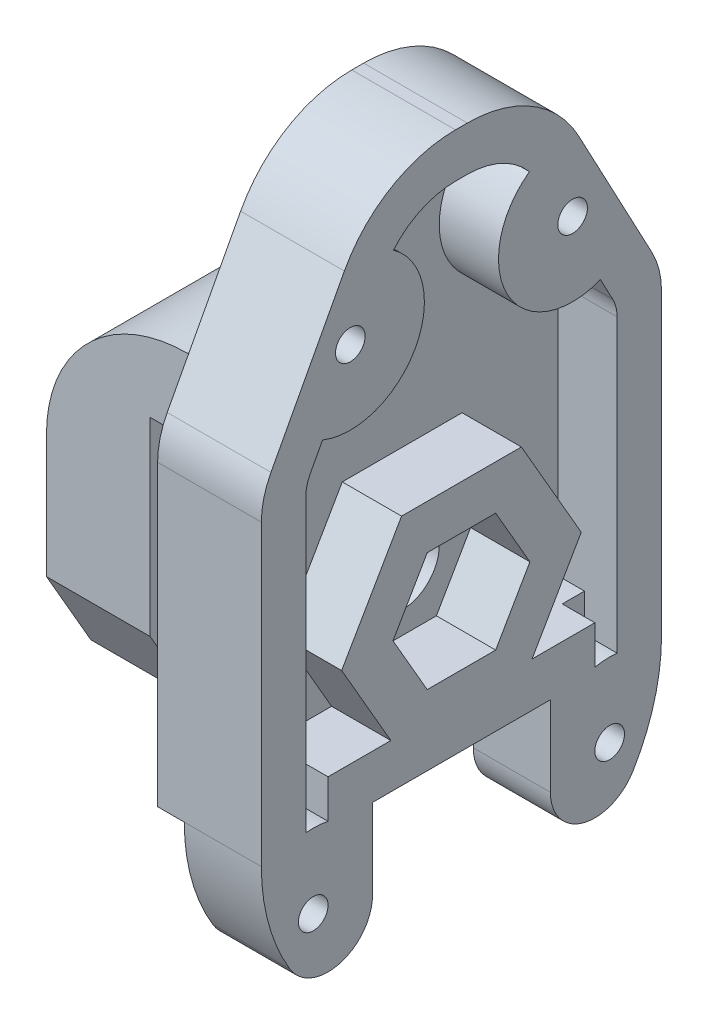
from build123d import *

# Parameters (mm, degrees)
BOSS_EXTRUDE1_DEPTH = 7
FILLET1_R           = 8.5
FILLET2_R           = 5.5
FILLET3_R           = 13.5
SKETCH3_W           = 27
SKETCH3_H           = 13.5
CUT_EXTRUDE1_DEPTH  = 1.8
BOSS_EXTRUDE2_DEPTH = 5
BOSS_EXTRUDE3_DEPTH = 7
SKETCH10_R          = 2.5
CUT_EXTRUDE3_DEPTH  = 21
CUT_EXTRUDE5_REACH  = 41.994
SKETCH12_W          = 12
SKETCH12_H          = 13.5
CUT_EXTRUDE6_REACH  = 39.182
SKETCH13_R          = 1
SKETCH17_R          = 2
CUT_EXTRUDE14_DEPTH = 4
FILLET4_R           = 3
CUT_EXTRUDE16_REACH = 42.725
SKETCH19_W          = 12
SKETCH19_H          = 4.5
CHAMFER5_SIZE       = 3
CHAMFER5_SIZE2      = 5.196152423
CUT_EXTRUDE17_DEPTH = 4
SHELL1_START        = 3
SHELL1_DEPTH        = 4
SHELL1_START_2      = -9
SHELL1_2_OUTLINE_R  = 5.5
SHELL1_2_DEPTH      = 1
SHELL1_START_3      = 4.8
SHELL1_3_DEPTH      = 2.2
SKETCH21_R          = 4.3
CUT_EXTRUDE18_DEPTH = 5
FILLET5_R           = 9.5
FILLET6_R           = 2.5


# Read off the part's stored shape, not the designer's step: Shell1
with BuildPart() as part:
    # Sketch2 → Boss-Extrude1 (new body)
    with BuildSketch(Plane(origin=(0, 0, 0), x_dir=(0, 0, -1), z_dir=(1, 0, 0))):
        Polygon((-13.5, -17.5), (13.5, -17.5), (13.5, 17.5), (5.5, 32.5), (-5.5, 32.5), (-13.5, 17.5), align=None)
    extrude(amount=BOSS_EXTRUDE1_DEPTH)

    # Fillet1
    fillet1_edges = [part.edges().sort_by_distance(p)[0] for p in [
        (3.5, 32.5, 5.5),
        (3.5, 32.5, -5.5),
    ]]
    fillet(fillet1_edges, radius=FILLET1_R)

    # Fillet2
    fillet2_edges = [part.edges().sort_by_distance(p)[0] for p in [
        (3.5, 17.5, -13.5),
        (3.5, 17.5, 13.5),
    ]]
    fillet(fillet2_edges, radius=FILLET2_R)

    # Fillet3
    fillet3_edges = [part.edges().sort_by_distance(p)[0] for p in [
        (3.5, -17.5, 13.5),
        (3.5, -17.5, -13.5),
    ]]
    fillet(fillet3_edges, radius=FILLET3_R - 0.0001)  # a hair under: the kernel refuses the full size

    # Sketch3 → Cut-Extrude1 (cut)
    with BuildSketch(Plane.ZY):
        with Locations((0, -10.75)):
            Rectangle(SKETCH3_W, SKETCH3_H)
    extrude(amount=-CUT_EXTRUDE1_DEPTH, mode=Mode.SUBTRACT)

    # Sketch6 → Boss-Extrude2 (add)
    with BuildSketch(Plane.ZY):
        with BuildLine():
            Line((-13.5, 14), (13.5, 14))
            Line((13.5, 14), (13.5, 16.125))
            ThreePointArc((13.5, 16.125), (13.293303509, 17.618632471), (12.688749833, 19))
            Line((12.688749833, 19), (-12.688749833, 19))
            ThreePointArc((-12.688749833, 19), (-13.293303509, 17.618632471), (-13.5, 16.125))
            Line((-13.5, 16.125), (-13.5, 14))
        make_face()
    extrude(amount=BOSS_EXTRUDE2_DEPTH)

    # Sketch9 → Boss-Extrude3 (add)
    with BuildSketch(Plane.ZY.offset(5)):
        with BuildLine():
            Line((-13.5, 14), (-13.5, -4))
            Line((-13.5, -4), (13.5, -4))
            Line((13.5, -4), (13.5, 14))
            Line((13.5, 14), (13.5, 16.125))
            ThreePointArc((13.5, 16.125), (13.293303509, 17.618632471), (12.688749833, 19))
            Line((12.688749833, 19), (-12.688749833, 19))
            ThreePointArc((-12.688749833, 19), (-13.293303509, 17.618632471), (-13.5, 16.125))
            Line((-13.5, 16.125), (-13.5, 14))
        make_face()
    extrude(amount=BOSS_EXTRUDE3_DEPTH)

    # Sketch10 → Cut-Extrude3 (cut)
    with BuildSketch(Plane(origin=(7, 0, 0), x_dir=(0, 0, -1), z_dir=(1, 0, 0))):
        with Locations((0, 4.75)):
            Circle(SKETCH10_R)
    extrude(amount=-CUT_EXTRUDE3_DEPTH, mode=Mode.SUBTRACT)

    # Sketch12 → Cut-Extrude5 (cut, up to next)
    with BuildSketch(Plane(origin=(7, 0, 0), x_dir=(0, 0, -1), z_dir=(1, 0, 0)), mode=Mode.PRIVATE) as cut_extrude5_sk1:
        with Locations((0, -10.75)):
            Rectangle(SKETCH12_W, SKETCH12_H)
    cut_extrude5_tool1 = extrude(cut_extrude5_sk1.sketch, amount=-CUT_EXTRUDE5_REACH, mode=Mode.PRIVATE) & part.part
    add(cut_extrude5_tool1.solids().sort_by_distance((7, -10.75, 0))[0], mode=Mode.SUBTRACT)

    # Sketch13 → Cut-Extrude6 (cut, up to next)
    with BuildSketch(Plane.ZY, mode=Mode.PRIVATE) as cut_extrude6_sk1:
        with Locations((-7.5, 23.5)):
            Circle(SKETCH13_R)
    cut_extrude6_tool1 = extrude(cut_extrude6_sk1.sketch, amount=-CUT_EXTRUDE6_REACH, mode=Mode.PRIVATE) & part.part
    # Sketch13 → Cut-Extrude6 (cut, up to next)
    with BuildSketch(Plane.ZY, mode=Mode.PRIVATE) as cut_extrude6_sk2:
        with Locations((-10, -8.5)):
            Circle(SKETCH13_R)
    cut_extrude6_tool2 = extrude(cut_extrude6_sk2.sketch, amount=-CUT_EXTRUDE6_REACH, mode=Mode.PRIVATE) & part.part
    # Sketch13 → Cut-Extrude6 (cut, up to next)
    with BuildSketch(Plane.ZY, mode=Mode.PRIVATE) as cut_extrude6_sk3:
        with Locations((10, -8.5)):
            Circle(SKETCH13_R)
    cut_extrude6_tool3 = extrude(cut_extrude6_sk3.sketch, amount=-CUT_EXTRUDE6_REACH, mode=Mode.PRIVATE) & part.part
    # Sketch13 → Cut-Extrude6 (cut, up to next)
    with BuildSketch(Plane.ZY, mode=Mode.PRIVATE) as cut_extrude6_sk4:
        with Locations((7.5, 23.5)):
            Circle(SKETCH13_R)
    cut_extrude6_tool4 = extrude(cut_extrude6_sk4.sketch, amount=-CUT_EXTRUDE6_REACH, mode=Mode.PRIVATE) & part.part
    add(cut_extrude6_tool1.solids().sort_by_distance((0, 23.5, -7.5))[0], mode=Mode.SUBTRACT)
    add(cut_extrude6_tool2.solids().sort_by_distance((0, -8.5, -10))[0], mode=Mode.SUBTRACT)
    add(cut_extrude6_tool3.solids().sort_by_distance((0, -8.5, 10))[0], mode=Mode.SUBTRACT)
    add(cut_extrude6_tool4.solids().sort_by_distance((0, 23.5, 7.5))[0], mode=Mode.SUBTRACT)

    # Sketch17 → Cut-Extrude14 (cut)
    with BuildSketch(Plane.ZY):
        with Locations((-7.5, 23.5)):
            Circle(SKETCH17_R)
        with Locations((7.5, 23.5)):
            Circle(SKETCH17_R)
        with Locations((-10, -8.5)):
            Circle(SKETCH17_R)
        with Locations((10, -8.5)):
            Circle(SKETCH17_R)
    extrude(amount=-CUT_EXTRUDE14_DEPTH, mode=Mode.SUBTRACT)

    # Fillet4
    fillet4_edges = [part.edges().sort_by_distance(p)[0] for p in [
        (4.4, -16.093424605, -6),
        (4.4, -16.093424605, 6),
    ]]
    fillet(fillet4_edges, radius=FILLET4_R)

    # Sketch19 → Cut-Extrude16 (cut, up to next)
    with BuildSketch(Plane.XZ.offset(4), mode=Mode.PRIVATE) as cut_extrude16_sk1:
        with Locations((-6, -11.25)):
            Rectangle(SKETCH19_W, SKETCH19_H)
    cut_extrude16_tool1 = extrude(cut_extrude16_sk1.sketch, amount=-CUT_EXTRUDE16_REACH, mode=Mode.PRIVATE) & part.part
    # Sketch19 → Cut-Extrude16 (cut, up to next)
    with BuildSketch(Plane.XZ.offset(4), mode=Mode.PRIVATE) as cut_extrude16_sk2:
        with Locations((-6, 11.25)):
            Rectangle(SKETCH19_W, SKETCH19_H)
    cut_extrude16_tool2 = extrude(cut_extrude16_sk2.sketch, amount=-CUT_EXTRUDE16_REACH, mode=Mode.PRIVATE) & part.part
    add(cut_extrude16_tool1.solids().sort_by_distance((-6, -4, -11.25))[0], mode=Mode.SUBTRACT)
    add(cut_extrude16_tool2.solids().sort_by_distance((-6, -4, 11.25))[0], mode=Mode.SUBTRACT)

    # Chamfer5
    chamfer5_edges = [part.edges().sort_by_distance(p)[0] for p in [
        (-8.5, -4, -9),
        (-8.5, -4, 9),
    ]]
    chamfer5_side = [part.faces().sort_by_distance(p)[0] for p in [
        (-8.5, -4, 0),
    ]]
    chamfer(chamfer5_edges, length=CHAMFER5_SIZE, length2=CHAMFER5_SIZE2, reference=chamfer5_side[0])

    # Sketch20 → Cut-Extrude17 (cut)
    with BuildSketch(Plane(origin=(7, 0, 0), x_dir=(0, 0, -1), z_dir=(1, 0, 0))):
        Polygon((2.309401077, 8.75), (-2.309401077, 8.75), (-4.618802154, 4.75), (-2.309401077, 0.75), (2.309401077, 0.75), (4.618802154, 4.75), align=None)
    extrude(amount=-CUT_EXTRUDE17_DEPTH, mode=Mode.SUBTRACT)

    # Shell1 outline → Shell1 (cut)
    with BuildSketch(Plane.YZ.offset(SHELL1_START)):
        with BuildLine():
            Line((4.75, 8.082903769), (11.75, 4.041451884))
            Line((11.75, 4.041451884), (11.75, -4.041451884))
            Line((11.75, -4.041451884), (4.75, -8.082903769))
            Line((4.75, -8.082903769), (-1, -4.763139721))
            Line((-1, -4.763139721), (-1, -10.5))
            Line((-1, -10.5), (16.125, -10.5))
            ThreePointArc((16.125, -10.5), (16.731339062, -10.42535625), (17.301470588, -10.205882353))
            Line((17.301470588, -10.205882353), (18.863900358, -9.372586476))
            ThreePointArc((18.863900358, -9.372586476), (21.090892464, -3.118653074), (27.564772739, -4.588364277))
            ThreePointArc((27.564772739, -4.588364277), (28.99280733, -2.706918934), (29.5, -0.4))
            Line((29.5, -0.4), (29.5, 0.4))
            ThreePointArc((29.5, 0.4), (28.99280733, 2.706918934), (27.564772739, 4.588364277))
            ThreePointArc((27.564772739, 4.588364277), (21.090892464, 3.118653074), (18.863900358, 9.372586476))
            Line((18.863900358, 9.372586476), (17.301470588, 10.205882353))
            ThreePointArc((17.301470588, 10.205882353), (16.731339062, 10.42535625), (16.125, 10.5))
            Line((16.125, 10.5), (-1, 10.5))
            Line((-1, 10.5), (-1, 4.763139721))
            Line((-1, 4.763139721), (4.75, 8.082903769))
        make_face()
    extrude(amount=SHELL1_DEPTH, mode=Mode.SUBTRACT)

    # Shell1 2 outline → Shell1 2 (cut)
    with BuildSketch(Plane.YZ.offset(SHELL1_START_2)):
        Polygon((16, -6), (16, 6), (2, 6), (-1, 4.267949192), (-1, -4.267949192), (2, -6), align=None)
        with Locations((4.75, 0)):
            Circle(SHELL1_2_OUTLINE_R, mode=Mode.SUBTRACT)
    extrude(amount=SHELL1_2_DEPTH, mode=Mode.SUBTRACT)

    # Shell1 3 outline → Shell1 3 (cut)
    with BuildSketch(Plane.YZ.offset(SHELL1_START_3)):
        with BuildLine():
            Line((-1, -10.5), (-1, -9))
            Line((-1, -9), (-3.601020514, -9))
            ThreePointArc((-3.601020514, -9), (-3.506398333, -9.747131669), (-3.525062814, -10.5))
            Line((-3.525062814, -10.5), (-1, -10.5))
        make_face()
        with BuildLine():
            Line((-3.601020514, 9), (-1, 9))
            Line((-1, 9), (-1, 10.5))
            Line((-1, 10.5), (-3.525062814, 10.5))
            ThreePointArc((-3.525062814, 10.5), (-3.506398333, 9.747131669), (-3.601020514, 9))
        make_face()
    extrude(amount=SHELL1_3_DEPTH, mode=Mode.SUBTRACT)

    # Sketch21 → Cut-Extrude18 (cut)
    with BuildSketch(Plane.ZY.offset(12)):
        with Locations((0, 4.75)):
            Circle(SKETCH21_R)
    extrude(amount=-CUT_EXTRUDE18_DEPTH, mode=Mode.SUBTRACT)

    # Fillet5
    fillet5_edges = [part.edges().sort_by_distance(p)[0] for p in [
        (-12, 19, 0),
    ]]
    fillet(fillet5_edges, radius=FILLET5_R)

    # Fillet6
    fillet6_edges = [part.edges().sort_by_distance(p)[0] for p in [
        (0, 19, 0),
    ]]
    fillet(fillet6_edges, radius=FILLET6_R - 0.0001)  # a hair under: the kernel refuses the full size


solid = part.part
